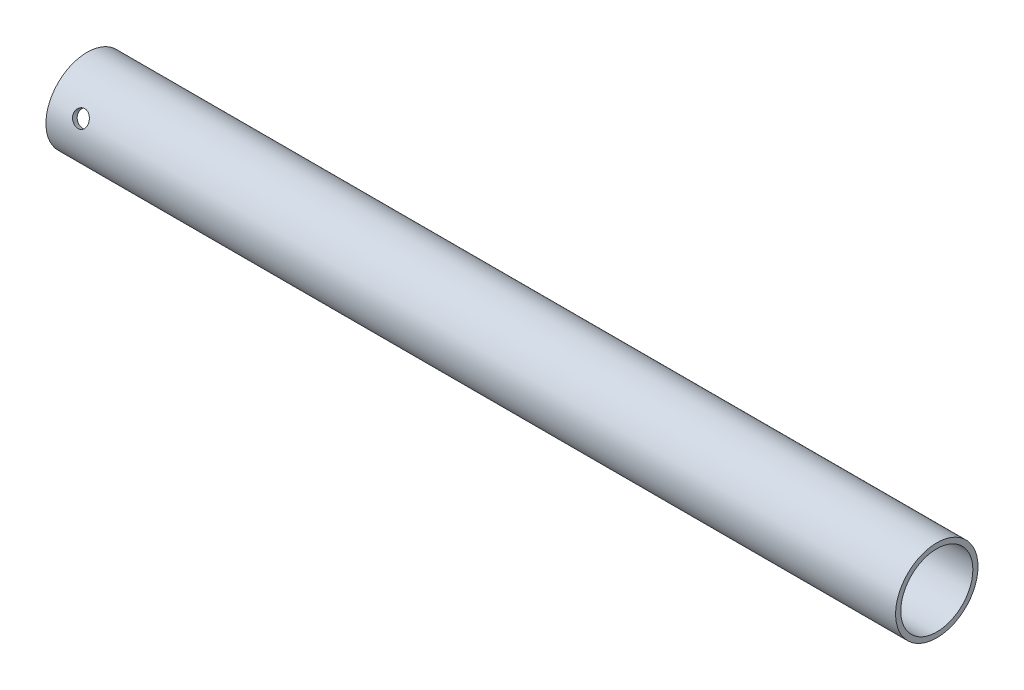
from build123d import *

# Parameters (mm, degrees)
SKETCH4_R              = 8
SKETCH4_R_2            = 7
CUT_EXTRUDE1_START     = -7.999999833
CUT_EXTRUDE1_OUTLINE_R = 1.5
CUT_EXTRUDE1_DEPTH     = 15.999999666


# Read off the part's stored shape, not the designer's step: Cut-Extrude1
with BuildPart() as part:
    # Sweep1: sweep along a path in Sketch2
    with BuildLine(Plane.XY) as sweep1_path:
        Line((0, 0), (165, 0))
    # Sketch4 → Sweep1 (sweep)
    with BuildSketch(Plane(origin=(0, 0, 0), x_dir=(0, 0, -1), z_dir=(1, 0, 0))):
        Circle(SKETCH4_R)
        Circle(SKETCH4_R_2, mode=Mode.SUBTRACT)
    sweep(path=sweep1_path.line)

    # Cut-Extrude1 outline → Cut-Extrude1 (cut)
    with BuildSketch(Plane(origin=(0, 0, 0), x_dir=(1, 0, 0), z_dir=(0, 0.42995875189106814, 0.9028485319655092)).offset(CUT_EXTRUDE1_START)):
        with Locations((6, 0)):
            Circle(CUT_EXTRUDE1_OUTLINE_R)
    extrude(amount=CUT_EXTRUDE1_DEPTH, mode=Mode.SUBTRACT)


solid = part.part
